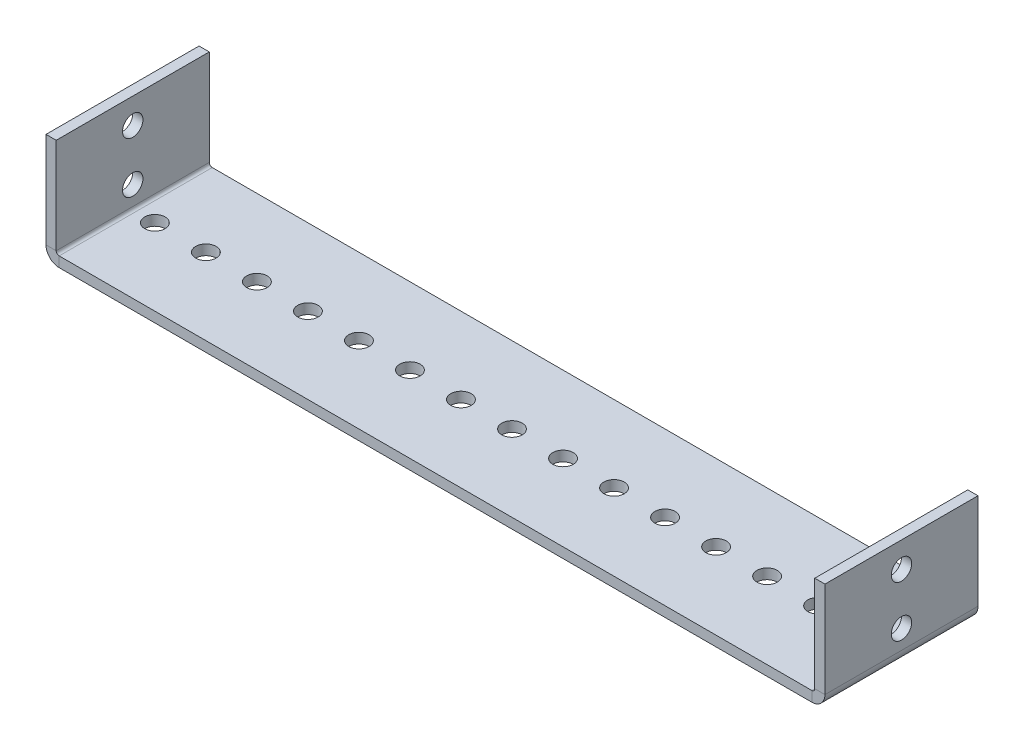
from build123d import *

# Parameters (mm, degrees)
SKETCH1_W                  = 241.3
SKETCH1_H                  = 38.1
BOSS_EXTRUDE1_DEPTH        = 2.54
SKETCH2_R                  = 2.54
CUT_EXTRUDE1_DEPTH         = 2.54
LPATTERN1_COUNT            = 19
LPATTERN1_PITCH            = 12.7
SKETCHED_START             = -120.65
SKETCHED_BEND2_OUTLINE_W   = 2.54
SKETCHED_BEND2_OUTLINE_H   = 38.1
SKETCHED_BEND2_DEPTH       = 23.699379955
SKETCHED_START_2           = -96.631937929
SKETCHED_BEND2_2_OUTLINE_W = 24.560620045
SKETCHED_BEND2_2_OUTLINE_H = 38.1
SKETCHED_BEND2_2_OUTLINE_R = 2.54
SKETCHED_BEND2_2_DEPTH     = 2.221317884
SKETCHED_START_3           = -96.950620045
SKETCHED_BEND2_3_OUTLINE_W = 24.560620045
SKETCHED_BEND2_3_OUTLINE_H = 38.1
SKETCHED_BEND2_3_OUTLINE_R = 2.54
SKETCHED_BEND2_3_DEPTH     = 3.2766
SKETCHED_START_4           = -20
SKETCHED_BEND2_4_DEPTH     = 40
SKETCHED_START_5           = 96.950620045
SKETCHED_BEND3_OUTLINE_W   = 2.54
SKETCHED_BEND3_OUTLINE_H   = 38.1
SKETCHED_BEND3_DEPTH       = 23.699379955
SKETCHED_START_6           = 94.410620045
SKETCHED_BEND3_2_OUTLINE_W = 24.560620045
SKETCHED_BEND3_2_OUTLINE_H = 38.1
SKETCHED_BEND3_2_OUTLINE_R = 2.54
SKETCHED_BEND3_2_DEPTH     = 2.221317884
SKETCHED_START_7           = 93.674020045
SKETCHED_BEND3_3_OUTLINE_W = 24.560620045
SKETCHED_BEND3_3_OUTLINE_H = 38.1
SKETCHED_BEND3_3_OUTLINE_R = 2.54
SKETCHED_BEND3_3_DEPTH     = 3.2766
SKETCHED_BEND3_4_DEPTH     = 40


with BuildPart() as part:
    # Sketch1 → Boss-Extrude1 (new body)
    with BuildSketch(Plane(origin=(0, 0, 0), x_dir=(1, 0, 0), z_dir=(0, 1, 0))):
        Rectangle(SKETCH1_W, SKETCH1_H)
    extrude(amount=BOSS_EXTRUDE1_DEPTH)

    # Sketch2 → Cut-Extrude1 (cut)
    with BuildSketch(Plane(origin=(0, 2.54, 0), x_dir=(1, 0, 0), z_dir=(0, 1, 0))):
        with Locations(Location((-114.3, 0, 0), (0, 0, 270))):
            Circle(SKETCH2_R)
    cut_extrude1 = extrude(amount=-CUT_EXTRUDE1_DEPTH, mode=Mode.SUBTRACT)

    # LPattern1: Cut-Extrude1 ×19
    with Locations(*[(i * LPATTERN1_PITCH, 0, 0) for i in range(1, LPATTERN1_COUNT)]):
        add(cut_extrude1, mode=Mode.SUBTRACT)

    # Sketched Bend2: read off the stored shape, not the designer's step
    # Sketched Bend2 outline → Sketched Bend2 (cut)
    with BuildSketch(Plane.YZ.offset(SKETCHED_START)):
        with Locations((1.27, 0)):
            Rectangle(SKETCHED_BEND2_OUTLINE_W, SKETCHED_BEND2_OUTLINE_H)
    extrude(amount=SKETCHED_BEND2_DEPTH, mode=Mode.SUBTRACT)

    # Sketched Bend2 2 outline → Sketched Bend2 2 (add)
    with BuildSketch(Plane.YZ.offset(SKETCHED_START_2)):
        with Locations((14.820310023, 0)):
            Rectangle(SKETCHED_BEND2_2_OUTLINE_W, SKETCHED_BEND2_2_OUTLINE_H)
        with Locations((8.050620045, 0)):
            Circle(SKETCHED_BEND2_2_OUTLINE_R, mode=Mode.SUBTRACT)
        with Locations((20.750620045, 0)):
            Circle(SKETCHED_BEND2_2_OUTLINE_R, mode=Mode.SUBTRACT)
    extrude(amount=SKETCHED_BEND2_2_DEPTH)

    # Sketched Bend2 3 outline → Sketched Bend2 3 (add)
    with BuildSketch(Plane.YZ.offset(SKETCHED_START_3)):
        with Locations((14.820310023, 0)):
            Rectangle(SKETCHED_BEND2_3_OUTLINE_W, SKETCHED_BEND2_3_OUTLINE_H)
        with Locations((8.050620045, 0)):
            Circle(SKETCHED_BEND2_3_OUTLINE_R, mode=Mode.SUBTRACT)
        with Locations((20.750620045, 0)):
            Circle(SKETCHED_BEND2_3_OUTLINE_R, mode=Mode.SUBTRACT)
    extrude(amount=SKETCHED_BEND2_3_DEPTH)

    # Sketched Bend2 4 outline → Sketched Bend2 4 (cut)
    with BuildSketch(Plane.XY.offset(SKETCHED_START_4)):
        with BuildLine():
            Line((-93.674020045, 27.100620045), (-94.410620045, 27.100620045))
            Line((-94.410620045, 27.100620045), (-94.410620045, 3.2766))
            ThreePointArc((-94.410620045, 3.2766), (-94.1948749, 2.755745145), (-93.674020045, 2.54))
            Line((-93.674020045, 2.54), (-93.674020045, 27.100620045))
        make_face()
        with BuildLine():
            ThreePointArc((-93.674020045, 0), (-95.990926125, 0.95969392), (-96.950620045, 3.2766))
            Line((-96.950620045, 3.2766), (-96.950620045, 0))
            Line((-96.950620045, 0), (-93.674020045, 0))
        make_face()
    extrude(amount=SKETCHED_BEND2_4_DEPTH, mode=Mode.SUBTRACT)

    # Sketched Bend3: read off the stored shape, not the designer's step
    # Sketched Bend3 outline → Sketched Bend3 (cut)
    with BuildSketch(Plane.YZ.offset(SKETCHED_START_5)):
        with Locations((1.27, 0)):
            Rectangle(SKETCHED_BEND3_OUTLINE_W, SKETCHED_BEND3_OUTLINE_H)
    extrude(amount=SKETCHED_BEND3_DEPTH, mode=Mode.SUBTRACT)

    # Sketched Bend3 2 outline → Sketched Bend3 2 (add)
    with BuildSketch(Plane.YZ.offset(SKETCHED_START_6)):
        with Locations((14.820310023, 0)):
            Rectangle(SKETCHED_BEND3_2_OUTLINE_W, SKETCHED_BEND3_2_OUTLINE_H)
        with Locations((8.050620045, 0)):
            Circle(SKETCHED_BEND3_2_OUTLINE_R, mode=Mode.SUBTRACT)
        with Locations((20.750620045, 0)):
            Circle(SKETCHED_BEND3_2_OUTLINE_R, mode=Mode.SUBTRACT)
    extrude(amount=SKETCHED_BEND3_2_DEPTH)

    # Sketched Bend3 3 outline → Sketched Bend3 3 (add)
    with BuildSketch(Plane.YZ.offset(SKETCHED_START_7)):
        with Locations((14.820310023, 0)):
            Rectangle(SKETCHED_BEND3_3_OUTLINE_W, SKETCHED_BEND3_3_OUTLINE_H)
        with Locations((8.050620045, 0)):
            Circle(SKETCHED_BEND3_3_OUTLINE_R, mode=Mode.SUBTRACT)
        with Locations((20.750620045, 0)):
            Circle(SKETCHED_BEND3_3_OUTLINE_R, mode=Mode.SUBTRACT)
    extrude(amount=SKETCHED_BEND3_3_DEPTH)

    # Sketched Bend3 4 outline → Sketched Bend3 4 (cut)
    with BuildSketch(Plane.XY.offset(SKETCHED_START_4)):
        with BuildLine():
            Line((96.950620045, 0), (96.950620045, 3.2766))
            ThreePointArc((96.950620045, 3.2766), (95.990926125, 0.95969392), (93.674020045, 0))
            Line((93.674020045, 0), (96.950620045, 0))
        make_face()
        with BuildLine():
            ThreePointArc((93.674020045, 2.54), (94.1948749, 2.755745145), (94.410620045, 3.2766))
            Line((94.410620045, 3.2766), (94.410620045, 27.100620045))
            Line((94.410620045, 27.100620045), (93.674020045, 27.100620045))
            Line((93.674020045, 27.100620045), (93.674020045, 2.54))
        make_face()
    extrude(amount=SKETCHED_BEND3_4_DEPTH, mode=Mode.SUBTRACT)


solid = part.part
